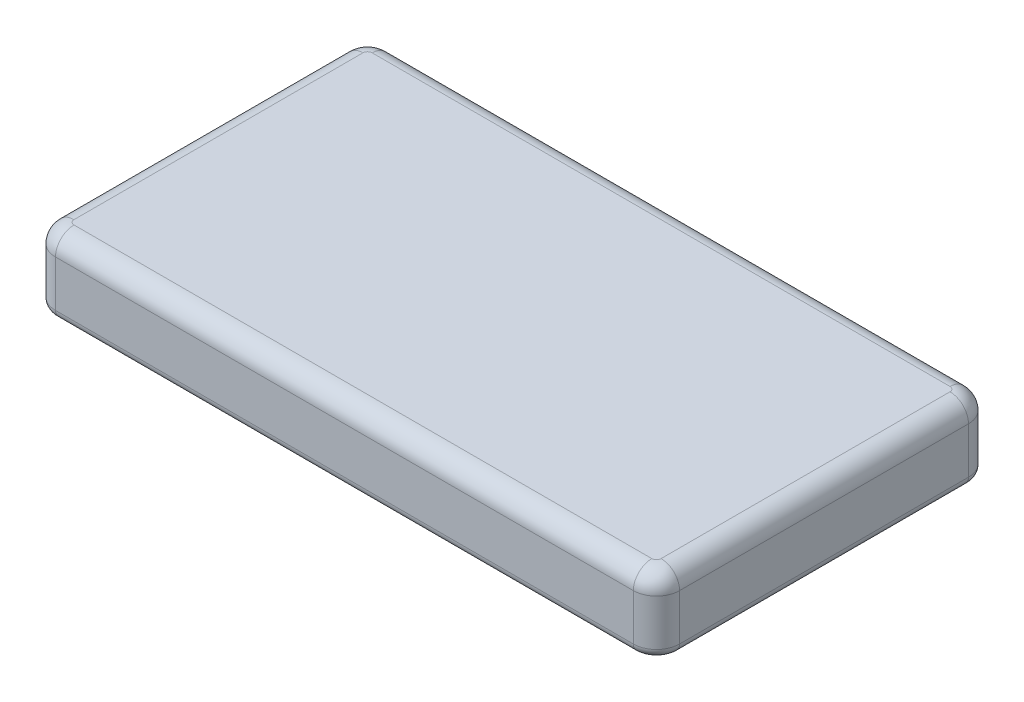
from build123d import *

# Parameters (mm, degrees)
SKETCH1_W           = 270
SKETCH1_H           = 145
BOSS_EXTRUDE1_DEPTH = 32
FILLET1_R           = 8
FILLET2_R           = 10
FILLET3_R           = 4
SKETCH2_R           = 3.521962556
SKETCH2_R_2         = 4.707421484
SKETCH2_W           = 23.153777818
SKETCH2_H           = 8.080231906
CUT_EXTRUDE1_DEPTH  = 33


with BuildPart() as part:
    # Sketch1 → Boss-Extrude1 (new body)
    with BuildSketch(Plane(origin=(0, 0, 0), x_dir=(1, 0, 0), z_dir=(0, 1, 0))):
        Rectangle(SKETCH1_W, SKETCH1_H)
    extrude(amount=BOSS_EXTRUDE1_DEPTH)

    # Fillet1
    fillet1_edges = [part.edges().sort_by_distance(p)[0] for p in [
        (-135, 32, 0),
        (0, 32, 72.5),
        (135, 32, 0),
        (0, 32, -72.5),
    ]]
    fillet(fillet1_edges, radius=FILLET1_R)

    # Fillet2
    # the kernel refuses this fillet: 10 mm, written as the material it takes off along each edge
    with BuildSketch(Plane(origin=(-125, 32, 62.5), x_dir=(-1, 0, 0), z_dir=(0, 0, -1))) as fillet2_piece_1:
        with BuildLine():
            CenterArc((2, -8), 8, 0, 90)
            Line((10, -8), (10, 0))
            Line((10, 0), (2, 0))
        make_face()
    revolve(axis=Axis((-125, 32, 62.5), (0, 1, 0)), revolution_arc=90, mode=Mode.SUBTRACT)
    with BuildSketch(Plane(origin=(-125, 32, -62.5), x_dir=(0, 0, -1), z_dir=(1, 0, 0))) as fillet2_piece_2:
        with BuildLine():
            CenterArc((2, -8), 8, 0, 90)
            Line((10, -8), (10, 0))
            Line((10, 0), (2, 0))
        make_face()
    revolve(axis=Axis((-125, 32, -62.5), (0, 1, 0)), revolution_arc=90, mode=Mode.SUBTRACT)
    with BuildSketch(Plane(origin=(125, 32, 62.5), x_dir=(0, 0, 1), z_dir=(-1, 0, 0))) as fillet2_piece_3:
        with BuildLine():
            CenterArc((2, -8), 8, 0, 90)
            Line((10, -8), (10, 0))
            Line((10, 0), (2, 0))
        make_face()
    revolve(axis=Axis((125, 32, 62.5), (0, 1, 0)), revolution_arc=90, mode=Mode.SUBTRACT)
    with BuildSketch(Plane(origin=(125, 32, -62.5), x_dir=(1, 0, 0), z_dir=(0, 0, 1))) as fillet2_piece_4:
        with BuildLine():
            CenterArc((2, -8), 8, 0, 90)
            Line((10, -8), (10, 0))
            Line((10, 0), (2, 0))
        make_face()
    revolve(axis=Axis((125, 32, -62.5), (0, 1, 0)), revolution_arc=90, mode=Mode.SUBTRACT)
    with BuildSketch(Plane(origin=(135, -25, -72.5), x_dir=(-1, 0, 0), z_dir=(0, 1, 0)), Plane(origin=(135, -25, 72.5), x_dir=(0, 0, -1), z_dir=(0, 1, 0))) as fillet2_piece_5:
        with BuildLine():
            CenterArc((FILLET2_R, FILLET2_R), FILLET2_R, 180, 90)
            Line((0, FILLET2_R), (0, 0))
            Line((0, 0), (FILLET2_R, 0))
        make_face()
    extrude(amount=57, mode=Mode.SUBTRACT)
    with BuildSketch(Plane(origin=(-135, -25, -72.5), x_dir=(1, 0, 0), z_dir=(0, 1, 0)), Plane(origin=(-135, -25, 72.5), x_dir=(0, 0, -1), z_dir=(0, 1, 0))) as fillet2_piece_6:
        with BuildLine():
            CenterArc((FILLET2_R, -FILLET2_R), FILLET2_R, 90, 90)
            Line((0, -FILLET2_R), (0, 0))
            Line((0, 0), (FILLET2_R, 0))
        make_face()
    extrude(amount=57, mode=Mode.SUBTRACT)

    # Fillet3
    fillet3_edges = [part.edges().sort_by_distance(p)[0] for p in [
        (-135, 0, 0),
        (135, 0, 0),
        (0, 0, 72.5),
        (0, 0, -72.5),
        (132.071067812, 0, 69.571067812),
        (132.071067812, 0, -69.571067812),
        (-132.071067812, 0, 69.571067812),
        (-132.071067812, 0, -69.571067812),
    ]]
    fillet(fillet3_edges, radius=FILLET3_R)

    # Sketch2 → Cut-Extrude1 (cut)
    with BuildSketch(Plane.ZY.offset(135)):
        with Locations((-45.200201046, 14)):
            Circle(SKETCH2_R)
        with Locations((48.220259023, 14)):
            Circle(SKETCH2_R_2)
        with Locations((0, 14)):
            Rectangle(SKETCH2_W, SKETCH2_H)
    extrude(amount=-CUT_EXTRUDE1_DEPTH, mode=Mode.SUBTRACT)


solid = part.part
